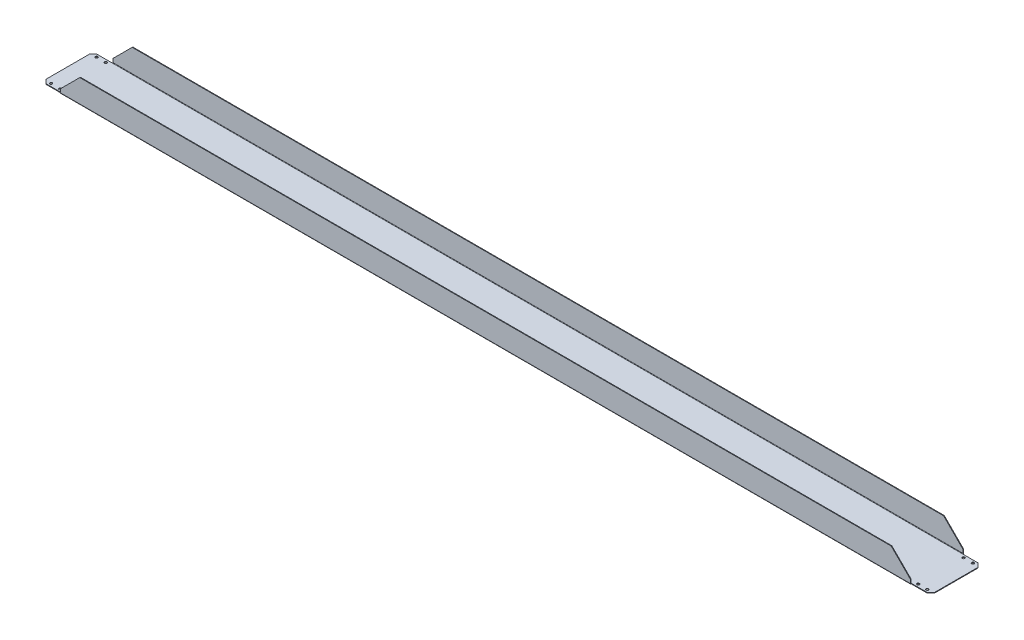
from build123d import *

# Parameters (mm, degrees)
SKETCH_1_W                  = 2300
SKETCH_1_H                  = 132
SM_BASE_FLANGE_1_DEPTH      = 1.6
SM_EDGE_FLANGE_1_DEPTH      = 2200
SM_EDGE_FLANGE_1_BEND_DEPTH = 2200
HOLE_WIZARD_6_4_6_4_1_D     = 6.4
HOLE_WIZARD_6_4_6_4_1_DEPTH = 2
CHAMFER_1_SIZE              = 50
CHAMFER_3_SIZE              = 10


# Sheet-metal steps are written as plain solids
with BuildPart() as part:
    # Sketch 1 → 基材-凸緣1 (new body)
    with BuildSketch(Plane(origin=(0, 0, 0), x_dir=(1, 0, 0), z_dir=(0, 1, 0))):
        Rectangle(SKETCH_1_W, SKETCH_1_H)
    extrude(amount=SM_BASE_FLANGE_1_DEPTH)

    # 邊線-凸緣1 section (across the edge) → 邊線-凸緣1 (add)
    with BuildSketch(Plane(origin=(1100, 1.6, -67), x_dir=(0, 0, 1), z_dir=(-1, 0, 0))):
        with BuildLine():
            Line((-1.6, 1), (-1.6, 60))
            Line((-1.6, 60), (0, 60))
            Line((0, 60), (0, 1))
            ThreePointArc((0, 1), (0.292893219, 0.292893219), (1, 0))
            Line((1, 0), (1, -1.6))
            ThreePointArc((1, -1.6), (-0.838477631, -0.838477631), (-1.6, 1))
        make_face()
    extrude(amount=SM_EDGE_FLANGE_1_DEPTH)

    # 邊線-凸緣1 section 2 (across the edge) → 邊線-凸緣1 bend (add)
    with BuildSketch(Plane(origin=(-1100, 1.6, 67), x_dir=(0, 0, -1), z_dir=(1, 0, 0))):
        with BuildLine():
            Line((-1.6, 1), (-1.6, 60))
            Line((-1.6, 60), (0, 60))
            Line((0, 60), (0, 1))
            ThreePointArc((0, 1), (0.292893219, 0.292893219), (1, 0))
            Line((1, 0), (1, -1.6))
            ThreePointArc((1, -1.6), (-0.838477631, -0.838477631), (-1.6, 1))
        make_face()
    extrude(amount=SM_EDGE_FLANGE_1_BEND_DEPTH)

    # Ø6.4 (6.4) 直徑孔1
    with Locations(Plane(origin=(0, 1.6, 0), x_dir=(-1, 0, 0), z_dir=(0, 1, 0))):
        with Locations((1110, -59), (1134, -59), (1134, 59), (1110, 59), (-1110, -59), (-1134, -59), (-1110, 59), (-1134, 59)):
            Hole(HOLE_WIZARD_6_4_6_4_1_D / 2, depth=HOLE_WIZARD_6_4_6_4_1_DEPTH)

    # 導角1
    chamfer_1_edges = [part.edges().sort_by_distance(p)[0] for p in [
        (1100, 61.6, -67.8),
        (-1100, 61.6, -67.8),
        (-1100, 61.6, 67.8),
        (1100, 61.6, 67.8),
    ]]
    chamfer(chamfer_1_edges, length=CHAMFER_1_SIZE)

    # 導角3
    chamfer_3_edges = [part.edges().sort_by_distance(p)[0] for p in [
        (-1150, 0.8, 66),
        (-1150, 0.8, -66),
        (1150, 0.8, -66),
        (1150, 0.8, 66),
    ]]
    chamfer(chamfer_3_edges, length=CHAMFER_3_SIZE)


solid = part.part
